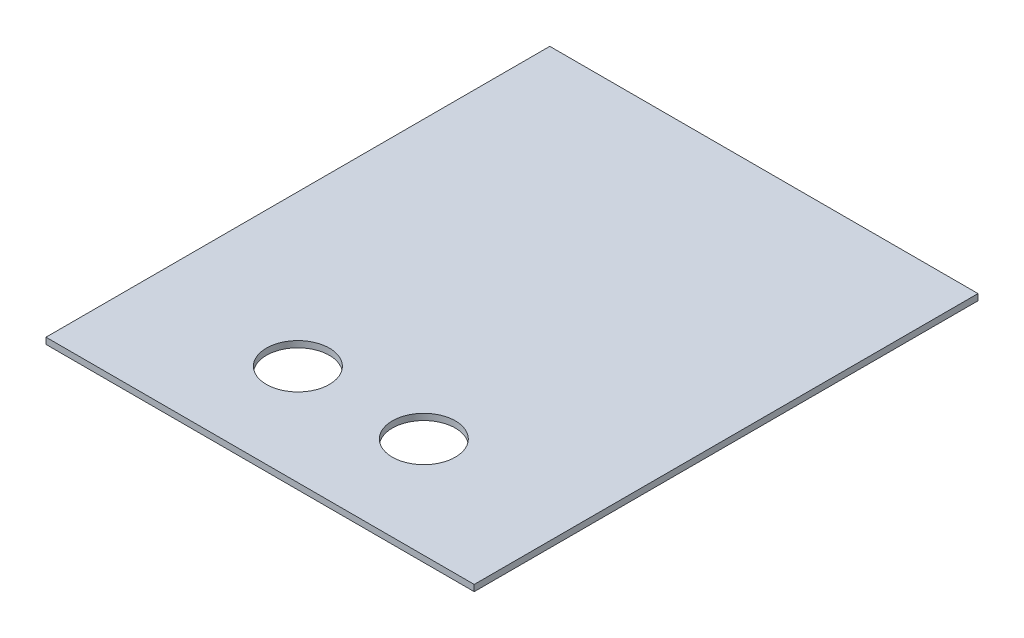
from build123d import *

# Parameters (mm, degrees)
SKETCH1_W           = 215.9
SKETCH1_H           = 254
BOSS_EXTRUDE1_DEPTH = 3.175
SKETCH2_R           = 15.875
CUT_EXTRUDE1_DEPTH  = 334.375


with BuildPart() as part:
    # Sketch1 → Boss-Extrude1 (new body)
    with BuildSketch(Plane(origin=(0, 0, 0), x_dir=(1, 0, 0), z_dir=(0, 1, 0))):
        with Locations((107.95, 127)):
            Rectangle(SKETCH1_W, SKETCH1_H)
    extrude(amount=BOSS_EXTRUDE1_DEPTH)

    # Sketch2 → Cut-Extrude1 (cut, through all)
    with BuildSketch(Plane(origin=(0, 3.175, 0), x_dir=(1, 0, 0), z_dir=(0, 1, 0))):
        with Locations((139.7, 50.8)):
            Circle(SKETCH2_R)
        with Locations((76.2, 50.8)):
            Circle(SKETCH2_R)
    extrude(amount=-CUT_EXTRUDE1_DEPTH, mode=Mode.SUBTRACT)


solid = part.part
